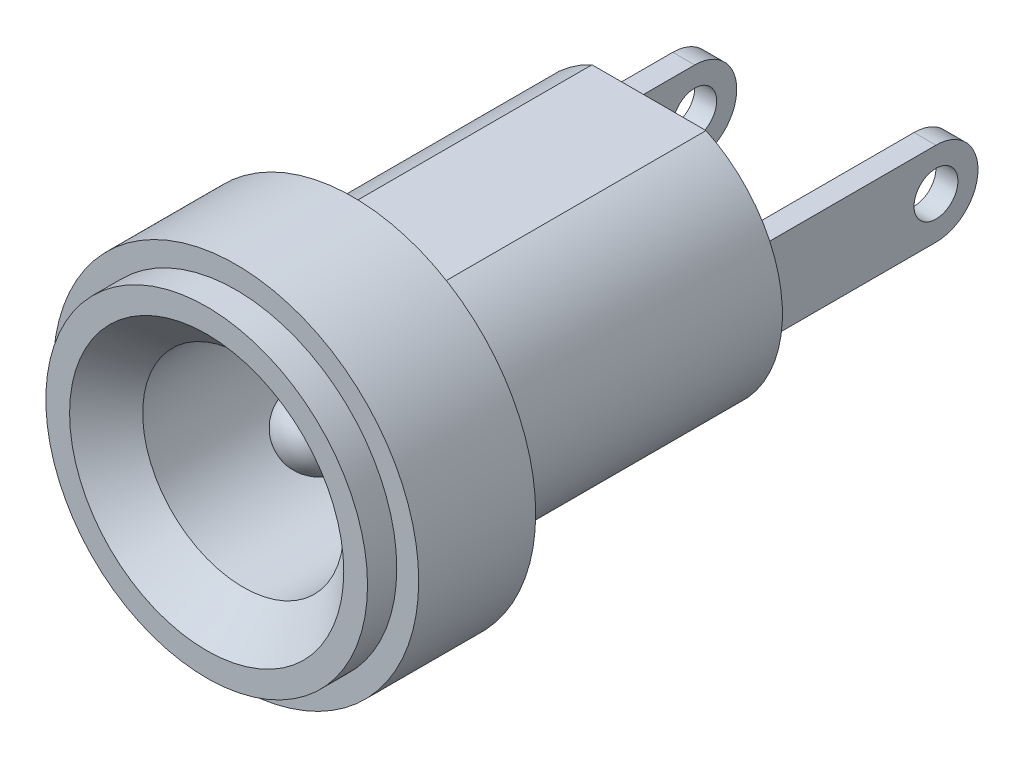
from build123d import *

# Parameters (mm, degrees)
ESQUISSE1_R             = 5
BOSS_EXTRU_1_DEPTH      = 3.2
BOSS_EXTRU_2_START      = 3.2
ESQUISSE1_3_R           = 4.4
BOSS_EXTRU_2_DEPTH      = 0.8
BOSS_EXTRU_3_DEPTH      = 8.1
ENL_V_START             = 4
ESQUISSE1_5_R           = 2.75
ENL_V_MAT_EXTRU_1_DEPTH = 9
BOSS_EXTRU_4_START      = -5
ESQUISSE1_6_R           = 0.95
BOSS_EXTRU_4_DEPTH      = 6.9
CHANFREIN1_SIZE         = 1
CONG_1_R                = 0.95
ESQUISSE2_W             = 0.6
ESQUISSE2_H             = 2.3
BOSS_EXTRU_5_DEPTH      = 6.1
ESQUISSE2_3_W           = 0.6
ESQUISSE2_3_H           = 2.3
BOSS_EXTRU_6_DEPTH      = 4.7
CONG_2_R                = 1.15
ENL_V_MAT_EXTRU_2_REACH = 18.731
ESQUISSE3_R             = 0.6
ENL_V_MAT_EXTRU_3_REACH = 19.001
ESQUISSE4_R             = 0.6


with BuildPart() as part:
    # Esquisse1 → Boss.-Extru.1 (new body)
    with BuildSketch(Plane.XY):
        Circle(ESQUISSE1_R)
    extrude(amount=BOSS_EXTRU_1_DEPTH)

    # Esquisse1<3> → Boss.-Extru.2 (add)
    with BuildSketch(Plane.XY.offset(BOSS_EXTRU_2_START)):
        Circle(ESQUISSE1_3_R)
    extrude(amount=BOSS_EXTRU_2_DEPTH)

    # Esquisse1<4> → Boss.-Extru.3 (add)
    with BuildSketch(Plane.XY):
        with BuildLine():
            Line((-1.559647396, 3.3), (1.559647396, 3.3))
            ThreePointArc((1.559647396, 3.3), (3.65, 0), (1.559647396, -3.3))
            Line((1.559647396, -3.3), (-1.559647396, -3.3))
            ThreePointArc((-1.559647396, -3.3), (-3.65, 0), (-1.559647396, 3.3))
        make_face()
    extrude(amount=-BOSS_EXTRU_3_DEPTH)

    # Esquisse1<5> → Enlèv. mat.-Extru.1 (cut)
    with BuildSketch(Plane.XY.offset(ENL_V_START)):
        Circle(ESQUISSE1_5_R)
    extrude(amount=-ENL_V_MAT_EXTRU_1_DEPTH, mode=Mode.SUBTRACT)

    # Esquisse1<6> → Boss.-Extru.4 (add)
    with BuildSketch(Plane.XY.offset(BOSS_EXTRU_4_START)):
        Circle(ESQUISSE1_6_R)
    extrude(amount=BOSS_EXTRU_4_DEPTH)

    # Chanfrein1
    chanfrein1_edges = [part.edges().sort_by_distance(p)[0] for p in [
        (-2.75, 0, 4),
    ]]
    chamfer(chanfrein1_edges, length=CHANFREIN1_SIZE)

    # Congé1
    cong_1_edges = [part.edges().sort_by_distance(p)[0] for p in [
        (-0.95, 0, 1.9),
    ]]
    fillet(cong_1_edges, radius=CONG_1_R)

    # Esquisse2 → Boss.-Extru.5 (add)
    with BuildSketch(Plane(origin=(0, 0, -8.1), x_dir=(-1, 0, 0), z_dir=(0, 0, -1))):
        with Locations((-2.6, 0)):
            Rectangle(ESQUISSE2_W, ESQUISSE2_H)
    extrude(amount=BOSS_EXTRU_5_DEPTH)

    # Esquisse2<3> → Boss.-Extru.6 (add)
    with BuildSketch(Plane(origin=(0, 0, -8.1), x_dir=(-1, 0, 0), z_dir=(0, 0, -1))):
        with Locations((2.6, 0)):
            Rectangle(ESQUISSE2_3_W, ESQUISSE2_3_H)
    extrude(amount=BOSS_EXTRU_6_DEPTH)

    # Congé2
    cong_2_edges = [part.edges().sort_by_distance(p)[0] for p in [
        (-2.6, -1.15, -12.8),
        (-2.6, 1.15, -12.8),
        (2.6, -1.15, -14.2),
        (2.6, 1.15, -14.2),
    ]]
    fillet(cong_2_edges, radius=CONG_2_R - 0.0001)  # a hair under: the kernel refuses the full size

    # Esquisse3 → Enlèv. mat.-Extru.2 (cut, up to next)
    with BuildSketch(Plane.ZY.offset(-2.3), mode=Mode.PRIVATE) as enl_v_mat_extru_2_sk1:
        with Locations((-13.05, 0)):
            Circle(ESQUISSE3_R)
    enl_v_mat_extru_2_tool1 = extrude(enl_v_mat_extru_2_sk1.sketch, amount=-ENL_V_MAT_EXTRU_2_REACH, mode=Mode.PRIVATE) & part.part
    add(enl_v_mat_extru_2_tool1.solids().sort_by_distance((2.3, 0, -13.05))[0], mode=Mode.SUBTRACT)

    # Esquisse4 → Enlèv. mat.-Extru.3 (cut, up to next)
    with BuildSketch(Plane.ZY.offset(2.9), mode=Mode.PRIVATE) as enl_v_mat_extru_3_sk1:
        with Locations(Location((-11.65, 0, 0), (0, 0, 270))):
            Circle(ESQUISSE4_R)
    enl_v_mat_extru_3_tool1 = extrude(enl_v_mat_extru_3_sk1.sketch, amount=-ENL_V_MAT_EXTRU_3_REACH, mode=Mode.PRIVATE) & part.part
    add(enl_v_mat_extru_3_tool1.solids().sort_by_distance((-2.9, 0, -11.65))[0], mode=Mode.SUBTRACT)


solid = part.part
